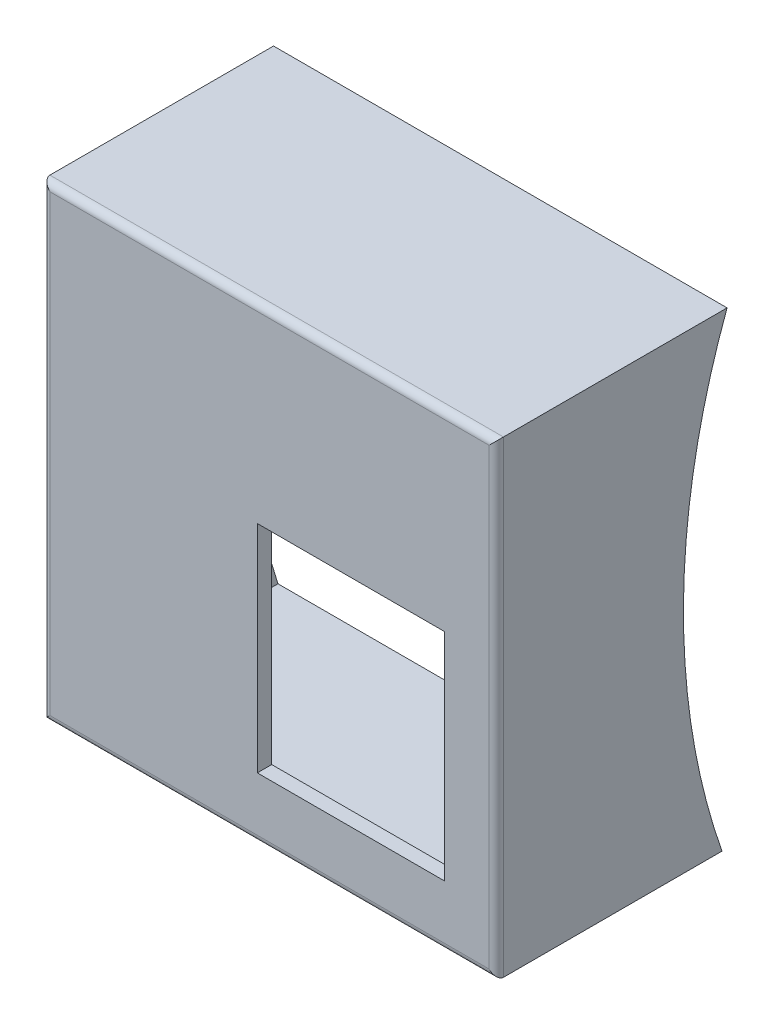
from build123d import *

# Parameters (mm, degrees)
ESQUISSE1_W             = 59
ESQUISSE1_H             = 61
BOSS_EXTRU_1_DEPTH      = 35
COQUE1_T                = 2
CONG_1_R                = 1
ESQUISSE2_W             = 28.002662862
ESQUISSE2_H             = 31.996726322
ENL_V_MAT_EXTRU_1_DEPTH = 10
EMPREINTE1_START        = -31.5
EMPREINTE1_DEPTH        = 63
ENL_V_START             = -70
ENL_V_MAT_EXTRU_2_DEPTH = 70
ESQUISSE6_W             = 30.866772499
ESQUISSE6_H             = 33.57762677
BOSS_EXTRU_2_DEPTH      = 2
ESQUISSE5_W             = 26
ESQUISSE5_H             = 30
ENL_V_MAT_EXTRU_3_DEPTH = 12


# Read off the part's stored shape, not the designer's step: Empreinte1
with BuildPart() as part:
    # Esquisse1 → Boss.-Extru.1 (new body)
    with BuildSketch(Plane.XY):
        Rectangle(ESQUISSE1_W, ESQUISSE1_H)
    extrude(amount=BOSS_EXTRU_1_DEPTH)

    # Coque1
    coque1_openings = [part.faces().sort_by_distance(p)[0] for p in [
        (0, 0, 0),
    ]]
    offset(amount=COQUE1_T, openings=coque1_openings, kind=Kind.INTERSECTION)

    # Congé1
    # the kernel refuses this fillet: 1 mm, written as the material it takes off along each edge
    with BuildSketch(Plane(origin=(-31.5, 35, 37), x_dir=(0, 0, -1), z_dir=(0, -1, 0)), Plane(origin=(31.5, -35, 37), x_dir=(0, 0, -1), z_dir=(0, 1, 0))) as cong_1_piece_1:
        with BuildLine():
            CenterArc((CONG_1_R, CONG_1_R), CONG_1_R, 180, 90)
            Line((0, CONG_1_R), (0, 0))
            Line((0, 0), (CONG_1_R, 0))
        make_face()
    extrude(amount=70, mode=Mode.SUBTRACT)
    with BuildSketch(Plane(origin=(-34, -32.5, 37), x_dir=(0, 0, -1), z_dir=(1, 0, 0)), Plane(origin=(34, 32.5, 37), x_dir=(0, 0, -1), z_dir=(-1, 0, 0))) as cong_1_piece_2:
        with BuildLine():
            CenterArc((CONG_1_R, CONG_1_R), CONG_1_R, 180, 90)
            Line((0, CONG_1_R), (0, 0))
            Line((0, 0), (CONG_1_R, 0))
        make_face()
    extrude(amount=68, mode=Mode.SUBTRACT)

    # Esquisse2 → Enlèv. mat.-Extru.1 (cut)
    with BuildSketch(Plane.XY.offset(37)):
        with Locations((12.997811926, -9.999029903)):
            Rectangle(ESQUISSE2_W, ESQUISSE2_H)
    extrude(amount=-ENL_V_MAT_EXTRU_1_DEPTH, mode=Mode.SUBTRACT)

    # Empreinte1 outline → Empreinte1 (cut)
    with BuildSketch(Plane.YZ.offset(EMPREINTE1_START)):
        with BuildLine():
            Line((-32.5, 5.64631504), (-32.5, 2.461866011))
            ThreePointArc((-32.5, 2.461866011), (0.066578718, 7.992846788), (32.5, 1.728105633))
            Line((32.5, 1.728105633), (32.5, 4.938683524))
            ThreePointArc((32.5, 4.938683524), (0.062060176, 10.993081225), (-32.5, 5.64631504))
        make_face()
    extrude(amount=EMPREINTE1_DEPTH, mode=Mode.SUBTRACT)

    # Esquisse3 → Enlèv. mat.-Extru.2 (cut)
    with BuildSketch(Plane(origin=(31.5, 0, 0), x_dir=(0, 0, -1), z_dir=(1, 0, 0)).offset(ENL_V_START)):
        with BuildLine():
            Line((-1.728105633, 32.5), (0, 32.5))
            Line((0, 32.5), (0, -32.5))
            Line((0, -32.5), (-2.461866011, -32.5))
            ThreePointArc((-2.461866011, -32.5), (-7.992846788, 0.066578718), (-1.728105633, 32.5))
        make_face()
    extrude(amount=ENL_V_MAT_EXTRU_2_DEPTH, mode=Mode.SUBTRACT)

    # Esquisse6 → Boss.-Extru.2 (add)
    with BuildSketch(Plane.XY.offset(37)):
        with Locations((12.6560139, -10.131028325)):
            Rectangle(ESQUISSE6_W, ESQUISSE6_H)
    extrude(amount=-BOSS_EXTRU_2_DEPTH)

    # Esquisse5 → Enlèv. mat.-Extru.3 (cut)
    with BuildSketch(Plane.XY.offset(37)):
        with Locations((11.311132579, -9.001205365)):
            Rectangle(ESQUISSE5_W, ESQUISSE5_H)
    extrude(amount=-ENL_V_MAT_EXTRU_3_DEPTH, mode=Mode.SUBTRACT)


solid = part.part
